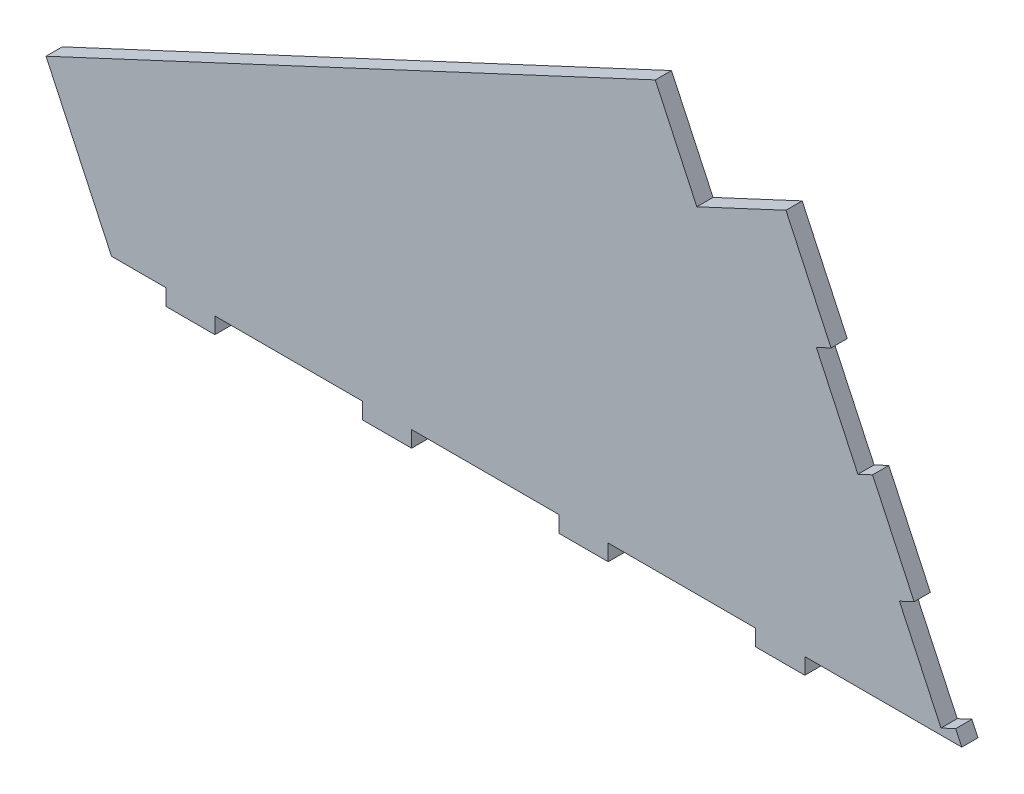
from build123d import *

# Parameters (mm, degrees)
BOSS_EXTRUDE1_DEPTH = 3.3
CUT_EXTRUDE1_DEPTH  = 3.3
SKETCH3_W           = 10
SKETCH3_H           = 3.717341371
SKETCH3_H_2         = 3.573770135
SKETCH3_H_3         = 3.710817969
SKETCH3_H_4         = 3.509523946
BOSS_EXTRUDE2_DEPTH = 3.3


with BuildPart() as part:
    # Sketch1 → Boss-Extrude1 (new body)
    with BuildSketch(Plane.XY):
        Polygon((321.54621123, 12.634626068), (148.58599223, 12.634626068), (135.256612252, 41.219573688), (259.198908878, 99.014815774), (267.651274112, 80.888660034), (285.777429853, 89.341025269), align=None)
    extrude(amount=-BOSS_EXTRUDE1_DEPTH)

    # Sketch2 → Cut-Extrude1 (cut)
    with BuildSketch(Plane.XY):
        Polygon((303.404032301, 51.540654333), (294.951667066, 69.666810074), (291.960851369, 68.27216981), (300.413216604, 50.14601407), align=None)
        Polygon((320.308762771, 15.288342852), (311.856397536, 33.414498593), (308.865581839, 32.019858329), (317.317947074, 13.893702588), align=None)
    extrude(amount=-CUT_EXTRUDE1_DEPTH, mode=Mode.SUBTRACT)

    # Sketch3 → Boss-Extrude2 (add)
    with BuildSketch(Plane.XY):
        with Locations((284.617848709, 11.193296751)):
            Rectangle(SKETCH3_W, SKETCH3_H)
        with Locations((244.617848709, 11.121511133)):
            Rectangle(SKETCH3_W, SKETCH3_H_2)
        with Locations((204.617848709, 11.19003505)):
            Rectangle(SKETCH3_W, SKETCH3_H_3)
        with Locations((164.617848709, 11.089388038)):
            Rectangle(SKETCH3_W, SKETCH3_H_4)
    extrude(amount=-BOSS_EXTRUDE2_DEPTH)


solid = part.part
